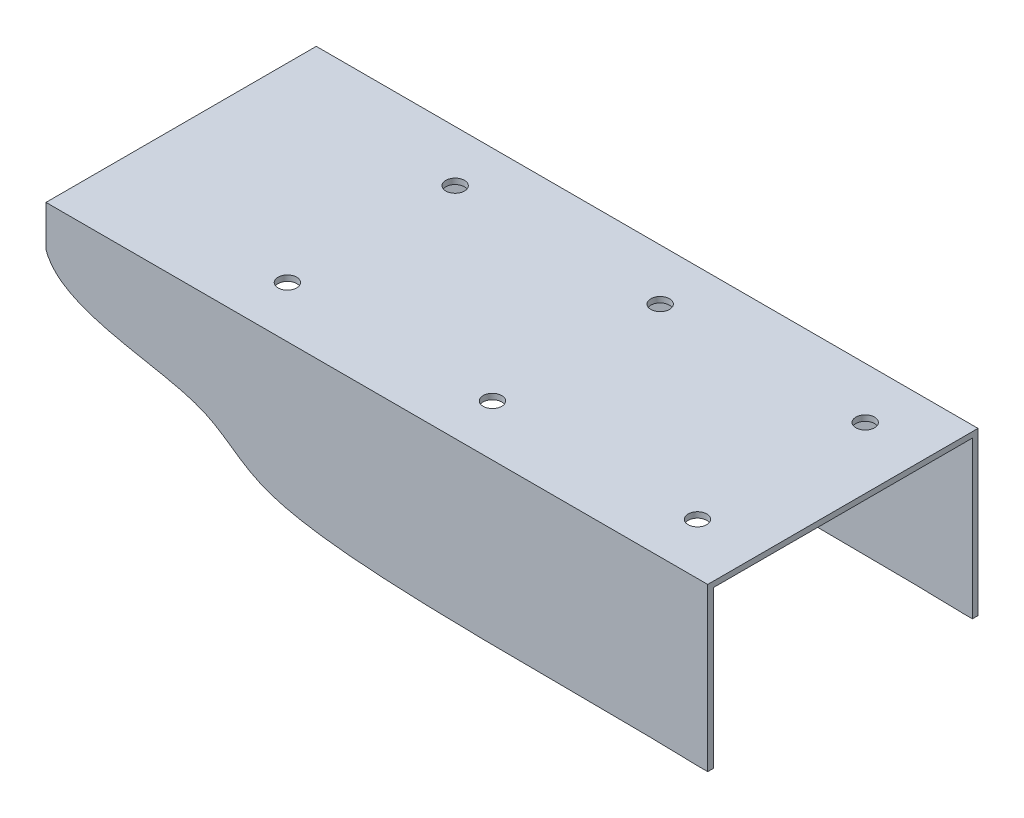
from build123d import *

# Parameters (mm, degrees)
EXTRUDE_1_DEPTH     = 355
CUT_EXTRUDE_1_DEPTH = 394.216225504
SKETCH_3_R          = 5
CUT_EXTRUDE_2_DEPTH = 10


with BuildPart() as part:
    # Эскиз1 → Вытянуть-Тонкостенный1 (new body)
    with BuildSketch(Plane(origin=(0, 0, 0), x_dir=(0, 0, -1), z_dir=(1, 0, 0))):
        Polygon((0, 0), (0, 87), (145, 87), (145, 0), (142, 0), (142, 84), (3, 84), (3, 0), align=None)
    extrude(amount=EXTRUDE_1_DEPTH)

    # Эскиз2 → Вырез-Вытянуть1 (cut, through all)
    with BuildSketch(Plane.XY):
        with BuildLine():
            Line((0, 65.12405332), (0, 0))
            Line((0, 0), (350.278484056, 0))
            add(Edge.make_bspline(
                [(0, 65.12405332), (7.933841156, 41.786887325), (88.835587811, 42.671964813), (115.548592719, -4.570720396), (275.808566843, 2.451761606), (350.278484056, 0)],
                knots=[0, 0, 0, 0, 0.332901295, 0.537301133, 1, 1, 1, 1], degree=3))
        make_face()
    extrude(amount=-CUT_EXTRUDE_1_DEPTH, mode=Mode.SUBTRACT)

    # Эскиз3 → Вырез-Вытянуть2 (cut)
    with BuildSketch(Plane(origin=(0, 87, 0), x_dir=(1, 0, 0), z_dir=(0, 1, 0))):
        with Locations((322, 117.5)):
            Circle(SKETCH_3_R)
        with Locations((212, 117.5)):
            Circle(SKETCH_3_R)
        with Locations((102, 117.5)):
            Circle(SKETCH_3_R)
        with Locations((212, 27.5)):
            Circle(SKETCH_3_R)
        with Locations((102, 27.5)):
            Circle(SKETCH_3_R)
        with Locations((322, 27.5)):
            Circle(SKETCH_3_R)
    extrude(amount=-CUT_EXTRUDE_2_DEPTH, mode=Mode.SUBTRACT)


solid = part.part
